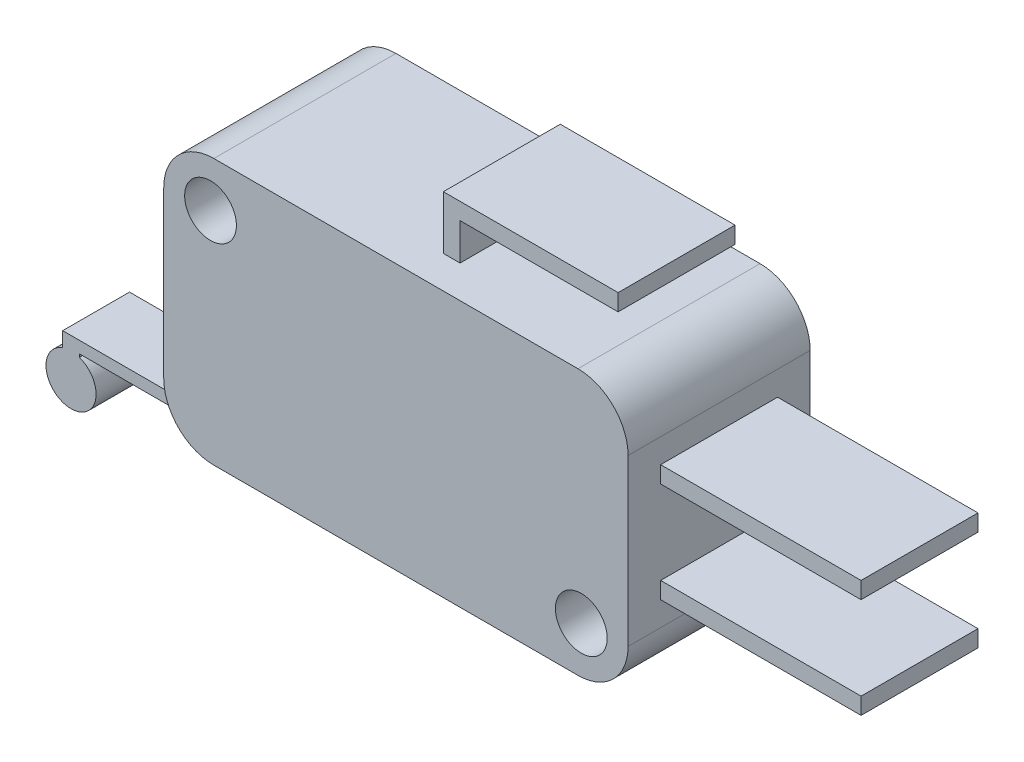
from build123d import *

# Parameters (mm, degrees)
SKETCH2_W           = 27.8
SKETCH2_H           = 15.9
BOSS_EXTRUDE1_DEPTH = 5.45
FILLET1_R           = 3
SKETCH3_R           = 1.55
CUT_EXTRUDE1_DEPTH  = 415.126272457
SKETCH4_W           = 12
SKETCH4_H           = 1
BOSS_EXTRUDE2_DEPTH = 3.5
BOSS_EXTRUDE3_DEPTH = 2


with BuildPart() as part:
    # Sketch2 → Boss-Extrude1 (new, symmetric)
    with BuildSketch(Plane(origin=(141.881478683, 374.181138364, -6.175335969), x_dir=(0.9999999999637573, 0, 8.513831885075729e-06), z_dir=(8.513831885075729e-06, 0, -0.9999999999637573))):
        with Locations((2.44537037, -0.420833333)):
            Rectangle(SKETCH2_W, SKETCH2_H)
    extrude(amount=BOSS_EXTRUDE1_DEPTH, both=True)

    # Fillet1
    fillet1_edges = [part.edges().sort_by_distance(p)[0] for p in [
        (158.226849053, 382.551971698, -6.175196807),
        (158.226849053, 366.651971698, -6.175196807),
        (130.426849054, 382.551971698, -6.175433492),
        (130.426849054, 366.651971698, -6.175433492),
    ]]
    fillet(fillet1_edges, radius=FILLET1_R)

    # Sketch3 → Cut-Extrude1 (cut, through all)
    with BuildSketch(Plane(origin=(9.8986e-05, 0, -11.626543923), x_dir=(-0.9999999999637574, 0, -8.513831885071589e-06), z_dir=(8.513831885071589e-06, 0, -0.9999999999637574))):
        with Locations((-155.426796473, 369.451971698)):
            Circle(SKETCH3_R)
        with Locations((-133.226796473, 379.751971698)):
            Circle(SKETCH3_R)
    extrude(amount=-CUT_EXTRUDE1_DEPTH, mode=Mode.SUBTRACT)

    # Sketch4 → Boss-Extrude2 (add, symmetric)
    with BuildSketch(Plane(origin=(141.881478683, 374.181138364, -6.175335969), x_dir=(0.9999999999637573, 0, 8.513831885075729e-06), z_dir=(8.513831885075729e-06, 0, -0.9999999999637573))):
        with Locations((22.34537037, 2.579166667)):
            Rectangle(SKETCH4_W, SKETCH4_H)
        with Locations((22.34537037, -3.420833333)):
            Rectangle(SKETCH4_W, SKETCH4_H)
        Polygon((3.336266503, -8.370833333), (3.336266503, -11.570833333), (13.799491044, -11.570833333), (13.799491044, -10.570833333), (4.336266503, -10.570833333), (4.336266503, -8.370833333), align=None)
    extrude(amount=BOSS_EXTRUDE2_DEPTH, both=True)

    # Sketch5 → Boss-Extrude3 (add, symmetric)
    with BuildSketch(Plane(origin=(141.881478683, 374.181138364, -6.175335969), x_dir=(0.9999999999637573, 0, 8.513831885075729e-06), z_dir=(8.513831885075729e-06, 0, -0.9999999999637573))):
        with BuildLine():
            Line((5.123770113, 7.529166667), (5.123770113, 8.529166667))
            Line((5.123770113, 8.529166667), (-20.95462963, 8.529166667))
            Line((-20.95462963, 8.529166667), (-20.95462963, 9.414953104))
            ThreePointArc((-20.95462963, 9.414953104), (-20.45462963, 12.329166667), (-19.95462963, 9.414953104))
            Line((-19.95462963, 9.414953104), (-19.95462963, 9.229166667))
            Line((-19.95462963, 9.229166667), (6.123770113, 9.229166667))
            Line((6.123770113, 9.229166667), (6.123770113, 7.529166667))
            Line((6.123770113, 7.529166667), (5.123770113, 7.529166667))
        make_face()
    extrude(amount=BOSS_EXTRUDE3_DEPTH, both=True)


solid = part.part
